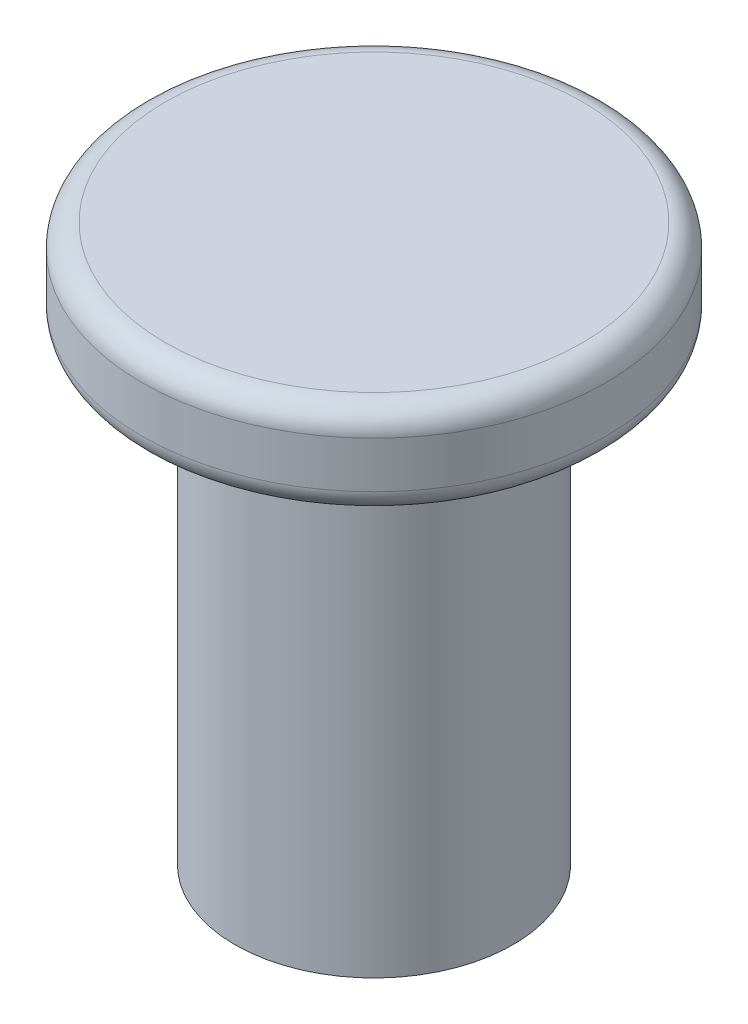
from build123d import *

# Parameters (mm, degrees)
SKETCH1_R                              = 2.5
BOSS_EXTRUDE1_DEPTH                    = 1
SKETCH3_R                              = 1.5
BOSS_EXTRUDE3_DEPTH                    = 5
FILLET1_R                              = 0.25
F_1_16_0_07874016_DIAMETER_HOLE1_D     = 2.000000064
F_1_16_0_07874016_DIAMETER_HOLE1_DEPTH = 2.899139362
F_1_16_0_07874016_DIAMETER_HOLE1_TIP   = 0.600860638
FILLET2_R                              = 0.15


with BuildPart() as part:
    # Sketch1 → Boss-Extrude1 (new body)
    with BuildSketch(Plane(origin=(0, 0, 0), x_dir=(1, 0, 0), z_dir=(0, 1, 0))):
        Circle(SKETCH1_R)
    extrude(amount=BOSS_EXTRUDE1_DEPTH)

    # Sketch3 → Boss-Extrude3 (add)
    with BuildSketch(Plane.XZ):
        Circle(SKETCH3_R)
    extrude(amount=BOSS_EXTRUDE3_DEPTH)

    # Fillet1
    fillet1_edges = [part.edges().sort_by_distance(p)[0] for p in [
        (-2.5, 0, 0),
        (-2.5, 1, 0),
    ]]
    fillet(fillet1_edges, radius=FILLET1_R)

    # 1/16 (0.07874016) Diameter Hole1
    with Locations(Plane(origin=(0, -5, 0), x_dir=(-1, 0, 0), z_dir=(0, -1, 0))):
        with Locations((0, 0)):
            Hole(F_1_16_0_07874016_DIAMETER_HOLE1_D / 2, depth=F_1_16_0_07874016_DIAMETER_HOLE1_DEPTH)
            with Locations((0, 0, -(F_1_16_0_07874016_DIAMETER_HOLE1_DEPTH + F_1_16_0_07874016_DIAMETER_HOLE1_TIP / 2))):  # 118° drill point
                Cone(0, F_1_16_0_07874016_DIAMETER_HOLE1_D / 2, F_1_16_0_07874016_DIAMETER_HOLE1_TIP, mode=Mode.SUBTRACT)

    # Fillet2
    fillet2_edges = [part.edges().sort_by_distance(p)[0] for p in [
        (-1.000000032, -5, 0),
    ]]
    fillet(fillet2_edges, radius=FILLET2_R)


solid = part.part
